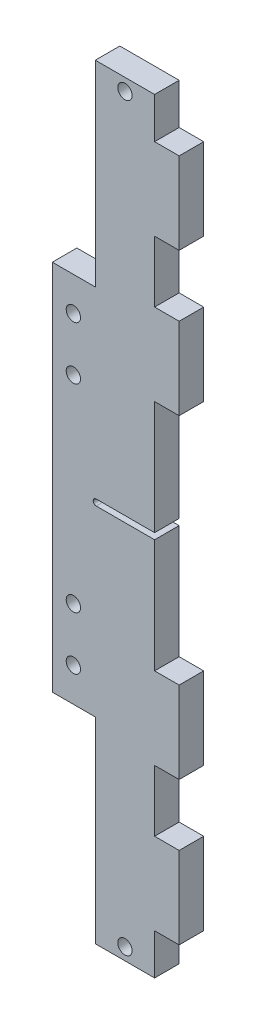
from build123d import *

# Parameters (mm, degrees)
ESBO_O1_W                = 10.5
ESBO_O1_H                = 91
RESSALTO_EXTRUS_O1_DEPTH = 6
ESBO_O2_W                = 6
ESBO_O2_H                = 20
RESSALTO_EXTRUS_O2_DEPTH = 6
ESBO_O3_R                = 1.75
CORTE_EXTRUS_O2_DEPTH    = 25.5
ESBO_O4_W                = 15
ESBO_O4_H                = 1.5
CORTE_EXTRUS_O3_DEPTH    = 6
FILETE1_R                = 0.75
ESBO_O5_R                = 1.75
CORTE_EXTRUS_O4_DEPTH    = 6


with BuildPart() as part:
    # Esboço1 → Ressalto-extrusão1 (new body)
    with BuildSketch(Plane.XY):
        with Locations((98.05, -93.5)):
            Rectangle(ESBO_O1_W, ESBO_O1_H)
        Polygon((117.8, 0), (103.3, 0), (103.3, -48), (103.3, -139), (103.3, -187), (117.8, -187), align=None)
    extrude(amount=-RESSALTO_EXTRUS_O1_DEPTH)

    # Esboço2 → Ressalto-extrusão2 (add)
    with BuildSketch(Plane.XY):
        with Locations((120.8, -20)):
            Rectangle(ESBO_O2_W, ESBO_O2_H)
        with Locations((120.8, -55)):
            Rectangle(ESBO_O2_W, ESBO_O2_H)
    ressalto_extrus_o2 = extrude(amount=-RESSALTO_EXTRUS_O2_DEPTH)

    # Espelhar1: Ressalto-extrusão2 across plane
    add(ressalto_extrus_o2.mirror(Plane.ZX.offset(-93.5)))

    # Esboço3 → Corte-extrusão2 (cut)
    with BuildSketch(Plane.XY):
        with Locations((97.95, -56.3)):
            Circle(ESBO_O3_R)
        with Locations((97.95, -69.3)):
            Circle(ESBO_O3_R)
        with Locations((97.95, -117.7)):
            Circle(ESBO_O3_R)
        with Locations((97.95, -130.7)):
            Circle(ESBO_O3_R)
    extrude(amount=-CORTE_EXTRUS_O2_DEPTH, mode=Mode.SUBTRACT)

    # Esboço4 → Corte-extrusão3 (cut)
    with BuildSketch(Plane.XY):
        with Locations((110.3, -93.5)):
            Rectangle(ESBO_O4_W, ESBO_O4_H)
    extrude(amount=-CORTE_EXTRUS_O3_DEPTH, mode=Mode.SUBTRACT)

    # Filete1
    filete1_edges = [part.edges().sort_by_distance(p)[0] for p in [
        (102.8, -94.25, -3),
        (102.8, -92.75, -3),
    ]]
    fillet(filete1_edges, radius=FILETE1_R - 0.0001)  # a hair under: the kernel refuses the full size

    # Esboço5 → Corte-extrusão4 (cut)
    with BuildSketch(Plane.XY):
        with Locations((110.55, -184)):
            Circle(ESBO_O5_R)
    corte_extrus_o4 = extrude(amount=-CORTE_EXTRUS_O4_DEPTH, mode=Mode.SUBTRACT)

    # Espelhar2: Corte-extrusão4 across plane
    add(corte_extrus_o4.mirror(Plane.ZX.offset(-93.5)), mode=Mode.SUBTRACT)


solid = part.part
